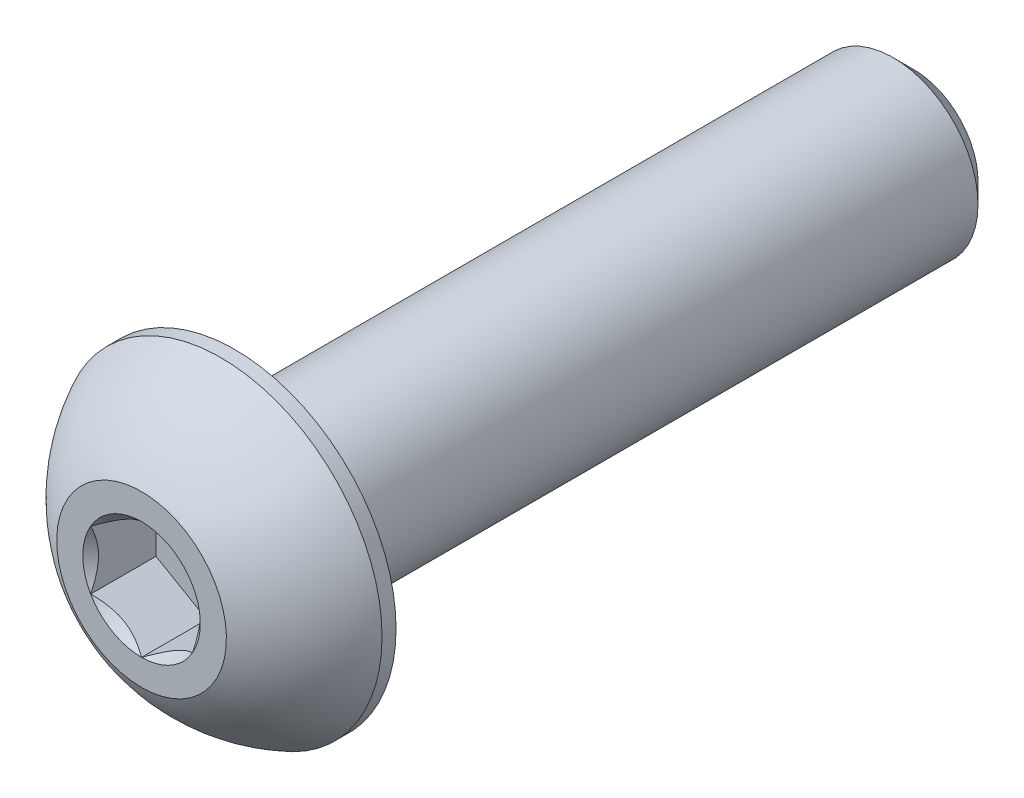
from build123d import *

# Parameters (mm, degrees)
CUT_EXTRUDE2_DEPTH = 1.925


with BuildPart() as part:
    # Sketch10 → Revolve3 (revolve)
    with BuildSketch(Plane(origin=(0, 0, 0), x_dir=(0, 0, -1), z_dir=(1, 0, 0))):
        Polygon((22.15, 2.5), (22.75, 1.9), (22.75, 0), (2.75, 0), (2.75, 2.5), align=None)
    revolve(axis=Axis((0, 0, 0), (0, 0, -1)))

    # Sketch7 → Revolve2 (revolve)
    with BuildSketch(Plane(origin=(0, 0, 0), x_dir=(0, 0, -1), z_dir=(1, 0, 0))):
        with BuildLine():
            Line((2.3375, 4.75), (2.75, 4.75))
            Line((2.75, 4.75), (2.75, 0))
            Line((2.75, 0), (0, 0))
            Line((0, 0), (0, 2.5))
            ThreePointArc((0, 2.5), (0.991875183, 3.808753282), (2.3375, 4.75))
        make_face()
    revolve(axis=Axis((0, 0, 0), (0, 0, -1)))

    # Sketch5 → Cut-Extrude2 (cut)
    with BuildSketch(Plane.XY):
        Polygon((1.5, -0.866025404), (1.5, 0.866025404), (0, 1.732050808), (-1.5, 0.866025404), (-1.5, -0.866025404), (0, -1.732050808), align=None)
    extrude(amount=-CUT_EXTRUDE2_DEPTH, mode=Mode.SUBTRACT)

    # Cut-Extrude3 cone 1 section (through the dimple's axis) → Cut-Extrude3 (revolve, cut)
    with BuildSketch(Plane(origin=(0, 0, 0), x_dir=(0, -1, 0), z_dir=(1, 0, 0))):
        Polygon((0, 0), (1.732050808, 0), (0, 1.732050808), align=None)
    revolve(axis=Axis((0, 0, 0), (0, 0, -1)), mode=Mode.SUBTRACT)


solid = part.part
